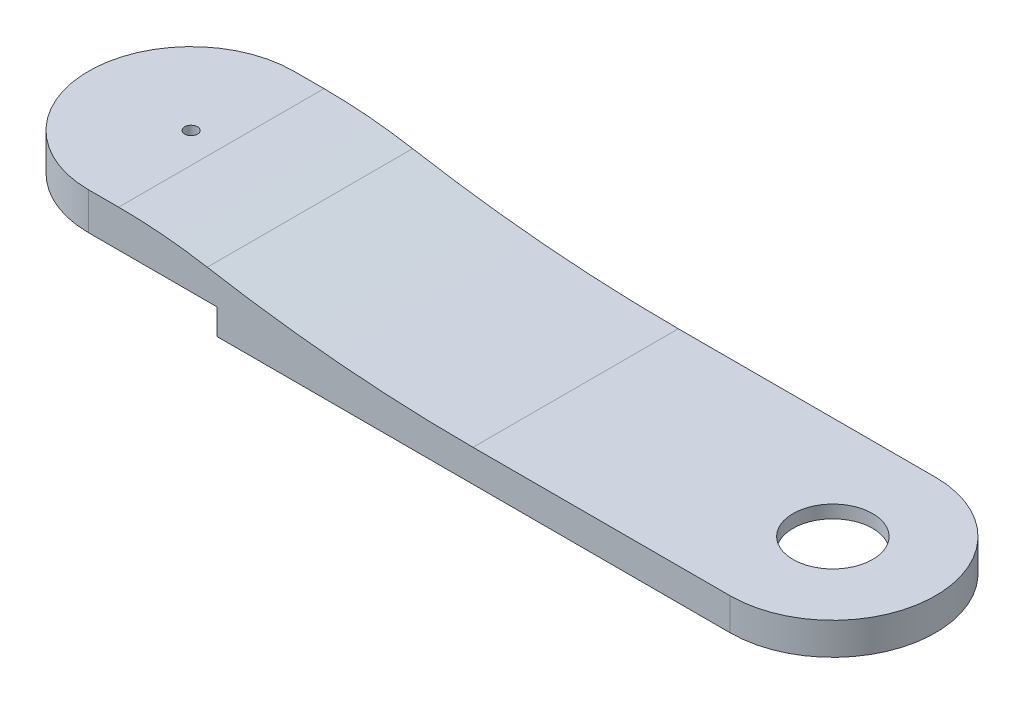
from build123d import *

# Parameters (mm, degrees)
BOSS_EXTRUDE1_DEPTH     = 7.5
CUT_EXTRUDE1_DEPTH      = 293.841680776
CUT_EXTRUDE1_DEPTH_BACK = 293.841680776
BOSS_EXTRUDE3_DEPTH     = 5
CUT_EXTRUDE2_DEPTH      = 293.841680776
CUT_EXTRUDE2_DEPTH_BACK = 293.841680776
SKETCH11_R              = 15.5
SKETCH12_W              = 30
SKETCH12_H              = 11
SKETCH12_H_2            = 58
BOSS_EXTRUDE4_DEPTH     = 7
BOSS_EXTRUDE5_DEPTH     = 5
BOSS_EXTRUDE6_START     = 2.5
BOSS_EXTRUDE6_DEPTH     = 2.5
CUT_EXTRUDE3_DEPTH      = 294.394359182
CUT_EXTRUDE3_DEPTH_BACK = 294.394359182
SKETCH15_R              = 2.5
FILLET1_R               = 200
FILLET2_R               = 600


with BuildPart() as part:
    # Sketch1 → Boss-Extrude1 (new body)
    with BuildSketch(Plane(origin=(0, 0, 0), x_dir=(1, 0, 0), z_dir=(0, 1, 0))):
        with BuildLine():
            Line((0, -40), (250, -40))
            ThreePointArc((250, -40), (290, 0), (250, 40))
            Line((250, 40), (0, 40))
            ThreePointArc((0, 40), (-40, 0), (0, -40))
        make_face()
        with BuildLine():
            Line((0, 29), (250, 29))
            ThreePointArc((250, 29), (279, 0), (250, -29))
            Line((250, -29), (0, -29))
            ThreePointArc((0, -29), (-29, 0), (0, 29))
        make_face(mode=Mode.SUBTRACT)
    extrude(amount=BOSS_EXTRUDE1_DEPTH)

    # Sketch9 → Cut-Extrude1 (cut, two sides: drawn at the far end of the back side and taken through both)
    with BuildSketch(Plane(origin=(0, 7.5, 0), x_dir=(1, 0, 0), z_dir=(0, 1, 0)).offset(-CUT_EXTRUDE1_DEPTH_BACK)):
        with BuildLine():
            Line((50, 29), (50, -29))
            Line((50, -29), (250, -29))
            ThreePointArc((250, -29), (279, 0), (250, 29))
            Line((250, 29), (50, 29))
        make_face()
        with BuildLine():
            Line((0, -40), (50, -40))
            Line((50, -40), (50, -29))
            Line((50, -29), (0, -29))
            ThreePointArc((0, -29), (-29, 0), (0, 29))
            Line((0, 29), (50, 29))
            Line((50, 29), (50, 40))
            Line((50, 40), (0, 40))
            ThreePointArc((0, 40), (-40, 0), (0, -40))
        make_face()
    extrude(amount=CUT_EXTRUDE1_DEPTH + CUT_EXTRUDE1_DEPTH_BACK, mode=Mode.SUBTRACT)

    # Sketch9<3> → Boss-Extrude3 (add)
    with BuildSketch(Plane(origin=(0, 7.5, 0), x_dir=(1, 0, 0), z_dir=(0, 1, 0))):
        with BuildLine():
            Line((50, 40), (50, -40))
            Line((50, -40), (250, -40))
            ThreePointArc((250, -40), (290, 0), (250, 40))
            Line((250, 40), (50, 40))
        make_face()
    extrude(amount=BOSS_EXTRUDE3_DEPTH)

    # Sketch11 → Cut-Extrude2 (cut, two sides: drawn at the far end of the back side and taken through both)
    with BuildSketch(Plane.XZ.offset(-7.5).offset(-CUT_EXTRUDE2_DEPTH_BACK)):
        with Locations(Location((250, 0, 0), (0, 0, 270))):
            Circle(SKETCH11_R)
    extrude(amount=CUT_EXTRUDE2_DEPTH + CUT_EXTRUDE2_DEPTH_BACK, mode=Mode.SUBTRACT)

    # Sketch12 → Boss-Extrude4 (add)
    with BuildSketch(Plane(origin=(0, 12.5, 0), x_dir=(1, 0, 0), z_dir=(0, 1, 0))):
        with Locations((65, -34.5)):
            Rectangle(SKETCH12_W, SKETCH12_H)
        with BuildLine():
            ThreePointArc((0, 40), (-40, 0), (0, -40))
            Line((0, -40), (50, -40))
            Line((50, -40), (50, -29))
            Line((50, -29), (0, -29))
            ThreePointArc((0, -29), (-29, 0), (0, 29))
            Line((0, 29), (50, 29))
            Line((50, 29), (50, 40))
            Line((50, 40), (0, 40))
        make_face()
        with Locations((65, 34.5)):
            Rectangle(SKETCH12_W, SKETCH12_H)
        with Locations((65, 0)):
            Rectangle(SKETCH12_W, SKETCH12_H_2)
    extrude(amount=BOSS_EXTRUDE4_DEPTH)

    # Sketch13 → Boss-Extrude5 (add)
    with BuildSketch(Plane(origin=(0, 19.5, 0), x_dir=(1, 0, 0), z_dir=(0, 1, 0))):
        with BuildLine():
            Line((80, -40), (80, 40))
            Line((80, 40), (0, 40))
            ThreePointArc((0, 40), (-40, 0), (0, -40))
            Line((0, -40), (80, -40))
        make_face()
    extrude(amount=BOSS_EXTRUDE5_DEPTH)

    # Sketch14 → Boss-Extrude6 (add)
    with BuildSketch(Plane.XZ.offset(-12.5).offset(BOSS_EXTRUDE6_START)):
        with BuildLine():
            Line((0, -40), (50, -40))
            Line((50, -40), (50, -29))
            Line((50, -29), (0, -29))
            ThreePointArc((0, -29), (-29, 0), (0, 29))
            Line((0, 29), (50, 29))
            Line((50, 29), (50, 40))
            Line((50, 40), (0, 40))
            ThreePointArc((0, 40), (-40, 0), (0, -40))
        make_face()
    extrude(amount=-BOSS_EXTRUDE6_DEPTH)

    # Sketch15 → Cut-Extrude3 (cut, two sides: drawn at the far end of the back side and taken through both)
    with BuildSketch(Plane.XZ.offset(-19.5).offset(-CUT_EXTRUDE3_DEPTH_BACK)):
        with Locations(Location((0, 0, 0), (0, 0, 270))):
            Circle(SKETCH15_R)
    extrude(amount=CUT_EXTRUDE3_DEPTH + CUT_EXTRUDE3_DEPTH_BACK, mode=Mode.SUBTRACT)

    # Fillet1
    # the kernel refuses this fillet: 200 mm, written as the material it takes off along each edge
    with BuildSketch(Plane(origin=(80, 24.5, 210.587221092), x_dir=(0, -1, 0), z_dir=(0, 0, -1))) as fillet1_piece_1:
        with BuildLine():
            CenterArc((200, 68.234888437), FILLET1_R, 180, 19.948443589)
            Line((0, 68.234888437), (-4, 68.234888437))
            Line((-4, 68.234888437), (-4, 0))
            Line((-4, 0), (0, -4))
            ThreePointArc((0, -4), (6, -4), (8.24, -1.364697769))
            Line((8.24, -1.364697769), (12, 0))
        make_face()
    extrude(amount=421.174442185, mode=Mode.SUBTRACT)

    # Fillet2
    fillet2_edges = [part.edges().sort_by_distance(p)[0] for p in [
        (80, 12.5, 0),
    ]]
    fillet(fillet2_edges, radius=FILLET2_R)


solid = part.part
